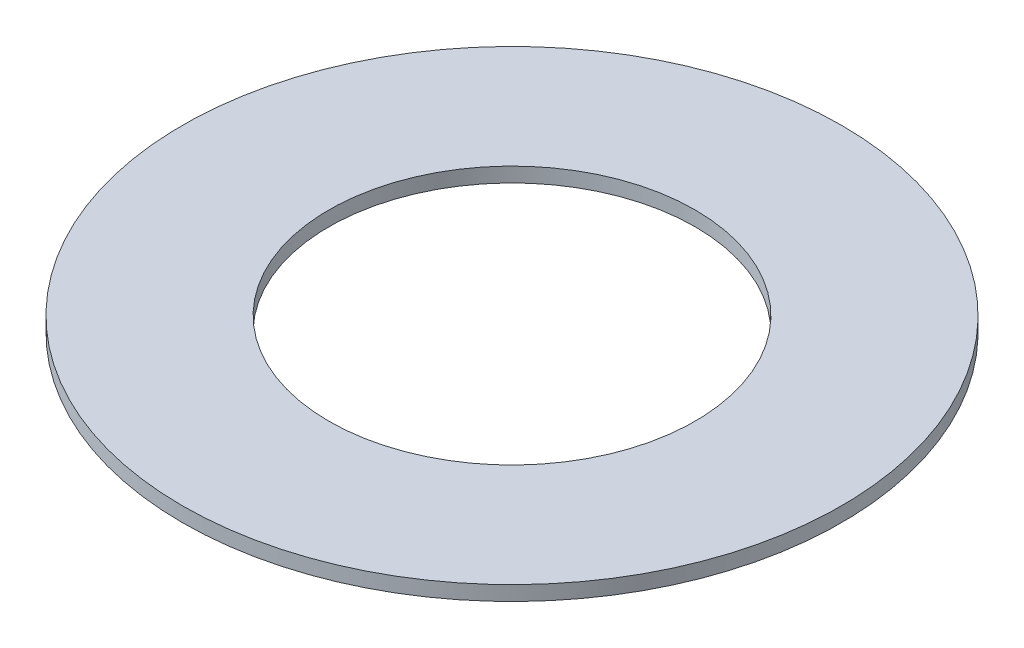
from build123d import *

# Parameters (mm, degrees)
SKIZZE1_R                       = 45
SKIZZE1_R_2                     = 25
AUFSATZ_LINEAR_AUSTRAGEN1_DEPTH = 2


with BuildPart() as part:
    # Skizze1 → Aufsatz-Linear austragen1 (new body)
    with BuildSketch(Plane(origin=(0, 0, 0), x_dir=(1, 0, 0), z_dir=(0, 1, 0))):
        Circle(SKIZZE1_R)
        Circle(SKIZZE1_R_2, mode=Mode.SUBTRACT)
    extrude(amount=AUFSATZ_LINEAR_AUSTRAGEN1_DEPTH)


solid = part.part
